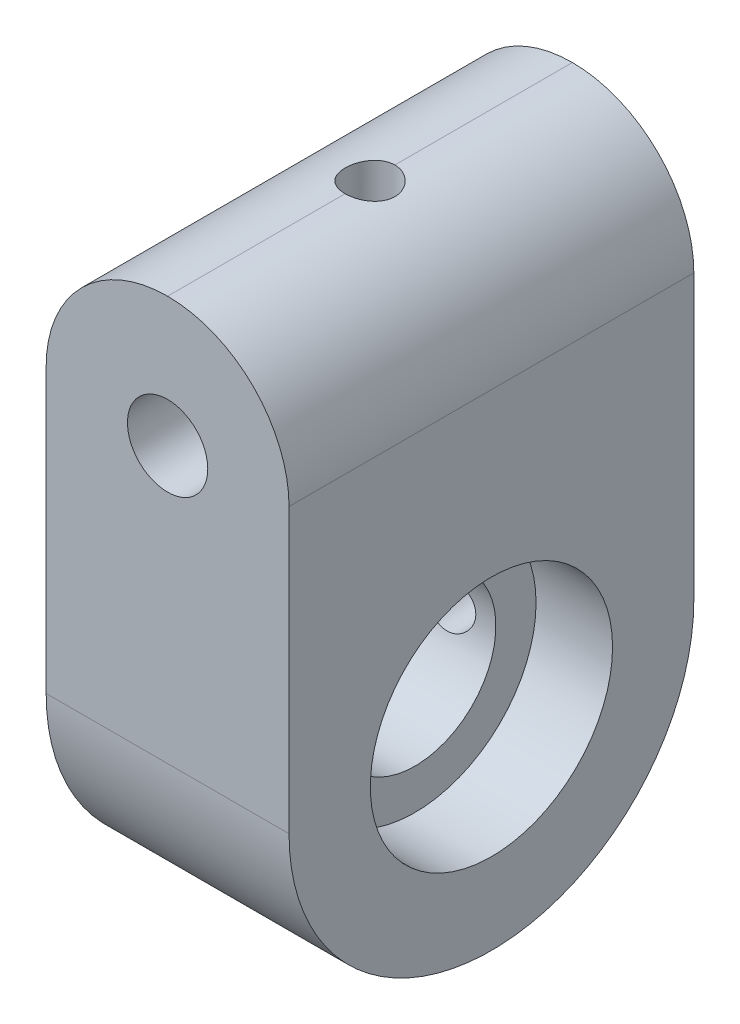
from build123d import *

# Parameters (mm, degrees)
SKETCH1_R               = 15.875
SKETCH1_R_2             = 9.5
BOSS_EXTRUDE1_DEPTH     = 6
BOSS_EXTRUDE2_START     = 13.050000011
SKETCH2_R               = 15.875
SKETCH2_R_2             = 9.5
SKETCH2_R_3             = 6.35
BOSS_EXTRUDE2_DEPTH     = 13.050000011
SKETCH3_R               = 1.95
CUT_EXTRUDE1_DEPTH      = 10.16
CUT_EXTRUDE3_REACH      = 39.82
CUT_EXTRUDE3_END_RADIUS = 6.35
BOSS_EXTRUDE3_REACH     = 31.444
SKETCH7_R               = 3.15
CUT_EXTRUDE4_DEPTH      = 31.75
CUT_EXTRUDE5_REACH      = 53.87
CUT_EXTRUDE5_END_RADIUS = 3.15
SKETCH8_R               = 1.95
FILLET1_R               = 9.525


with BuildPart() as part:
    # Sketch1 → Boss-Extrude1 (new body)
    with BuildSketch(Plane(origin=(0, 0, 0), x_dir=(0, 0, -1), z_dir=(1, 0, 0))):
        Circle(SKETCH1_R)
        Circle(SKETCH1_R_2, mode=Mode.SUBTRACT)
    extrude(amount=BOSS_EXTRUDE1_DEPTH)

    # Sketch2 → Boss-Extrude2 (add)
    # profile 1 of 2: a face of its own
    with BuildSketch(Plane.ZY.offset(BOSS_EXTRUDE2_START)):
        Circle(SKETCH2_R)
        with Locations(Location((0, 0, 0), (0, 0, 180))):
            Circle(SKETCH2_R_2, mode=Mode.SUBTRACT)
    # profile 2 of 2: a face of its own
    with BuildSketch(Plane.ZY.offset(BOSS_EXTRUDE2_START)):
        with Locations(Location((0, 0, 0), (0, 0, 180))):
            Circle(SKETCH2_R_2)
        Circle(SKETCH2_R_3, mode=Mode.SUBTRACT)
    extrude(amount=-BOSS_EXTRUDE2_DEPTH)

    # Sketch3 → Cut-Extrude1 (cut)
    with BuildSketch(Plane.ZY.offset(13.050000011)):
        with Locations((0, -12.7)):
            Circle(SKETCH3_R)
        with Locations((0, 12.7)):
            Circle(SKETCH3_R)
    extrude(amount=-CUT_EXTRUDE1_DEPTH, mode=Mode.SUBTRACT)

    # Cut-Extrude3: up to this cylinder (the profile starts outside it)
    cut_extrude3_end = Plane(origin=(-3.525, 0, 0), z_dir=(1, 0, 0)) * Cylinder(CUT_EXTRUDE3_END_RADIUS, 93.34, mode=Mode.PRIVATE)
    # Sketch5 → Cut-Extrude3 (cut, up to the surface)
    with BuildSketch(Plane.XY.offset(-15.875), mode=Mode.PRIVATE) as cut_extrude3_sk1:
        with BuildLine():
            ThreePointArc((-1.575000006, 0), (-3.525000006, 1.95), (-5.475000006, 0))
            Line((-5.475000006, 0), (-1.575000006, 0))
        make_face()
    cut_extrude3_tool1 = extrude(cut_extrude3_sk1.sketch, amount=CUT_EXTRUDE3_REACH, mode=Mode.PRIVATE) - cut_extrude3_end
    add(cut_extrude3_tool1.solids().sort_by_distance((-3.525, 0.827606, -15.875))[0], mode=Mode.SUBTRACT)
    # Sketch5 → Cut-Extrude3 (cut, up to the surface)
    with BuildSketch(Plane.XY.offset(-15.875), mode=Mode.PRIVATE) as cut_extrude3_sk2:
        with BuildLine():
            Line((-1.575000006, 0), (-5.475000006, 0))
            ThreePointArc((-5.475000006, 0), (-3.525000006, -1.95), (-1.575000006, 0))
        make_face()
    cut_extrude3_tool2 = extrude(cut_extrude3_sk2.sketch, amount=CUT_EXTRUDE3_REACH, mode=Mode.PRIVATE) - cut_extrude3_end
    add(cut_extrude3_tool2.solids().sort_by_distance((-3.525, -0.827606, -15.875))[0], mode=Mode.SUBTRACT)
    # Sketch5 → Cut-Extrude3 (cut, up to the surface)
    with BuildSketch(Plane.XY.offset(-15.875), mode=Mode.PRIVATE) as cut_extrude3_sk3:
        with BuildLine():
            ThreePointArc((-1.575000006, 0), (-3.525000006, 1.95), (-5.475000006, 0))
            Line((-5.475000006, 0), (-1.575000006, 0))
        make_face()
    cut_extrude3_tool3 = extrude(cut_extrude3_sk3.sketch, amount=CUT_EXTRUDE3_REACH, mode=Mode.PRIVATE) - cut_extrude3_end
    add(cut_extrude3_tool3.solids().sort_by_distance((-3.525, 0.827606, -15.875))[0], mode=Mode.SUBTRACT)
    # Sketch5 → Cut-Extrude3 (cut, up to the surface)
    with BuildSketch(Plane.XY.offset(-15.875), mode=Mode.PRIVATE) as cut_extrude3_sk4:
        with BuildLine():
            Line((-1.575000006, 0), (-5.475000006, 0))
            ThreePointArc((-5.475000006, 0), (-3.525000006, -1.95), (-1.575000006, 0))
        make_face()
    cut_extrude3_tool4 = extrude(cut_extrude3_sk4.sketch, amount=CUT_EXTRUDE3_REACH, mode=Mode.PRIVATE) - cut_extrude3_end
    add(cut_extrude3_tool4.solids().sort_by_distance((-3.525, -0.827606, -15.875))[0], mode=Mode.SUBTRACT)

    # Boss-Extrude3: up to this face of the body (flat: up to its plane)
    boss_extrude3_end = Plane(part.part.faces().sort_by_distance((6, 0, 15.425987194))[0])
    # Sketch6 → Boss-Extrude3 (add, up to the picked face)
    with BuildSketch(Plane.ZY.offset(13.050000011), mode=Mode.PRIVATE) as boss_extrude3_sk1:
        with BuildLine():
            Line((-15.875, 31.75), (-15.875, 0))
            ThreePointArc((-15.875, 0), (0, 15.875), (15.875, 0))
            Line((15.875, 0), (15.875, 31.75))
            Line((15.875, 31.75), (-15.875, 31.75))
        make_face()
    boss_extrude3_tool1 = split(extrude(boss_extrude3_sk1.sketch, amount=-BOSS_EXTRUDE3_REACH, mode=Mode.PRIVATE), bisect_by=boss_extrude3_end, keep=Keep.BOTH, mode=Mode.PRIVATE)
    add(boss_extrude3_tool1.solids().sort_by(Axis((-13.05, 21.783545, 0), (1, 0, 0)))[0])

    # Sketch7 → Cut-Extrude4 (cut)
    with BuildSketch(Plane.XY.offset(15.875)):
        with Locations((-3.525000006, 21.59)):
            Circle(SKETCH7_R)
    extrude(amount=-CUT_EXTRUDE4_DEPTH, mode=Mode.SUBTRACT)

    # Cut-Extrude5: up to this cylinder (the profile starts outside it)
    cut_extrude5_end = Plane(origin=(-3.525000006, 21.59, 0), z_dir=(0, 0, 1)) * Cylinder(CUT_EXTRUDE5_END_RADIUS, 115.04, mode=Mode.PRIVATE)
    # Sketch8 → Cut-Extrude5 (cut, up to the surface)
    with BuildSketch(Plane(origin=(0, 31.75, 0), x_dir=(1, 0, 0), z_dir=(0, 1, 0)), mode=Mode.PRIVATE) as cut_extrude5_sk1:
        with Locations(Location((-3.525000006, 0, 0), (0, 0, 270))):
            Circle(SKETCH8_R)
    cut_extrude5_tool1 = extrude(cut_extrude5_sk1.sketch, amount=-CUT_EXTRUDE5_REACH, mode=Mode.PRIVATE) - cut_extrude5_end
    add(cut_extrude5_tool1.solids().sort_by_distance((-3.525, 31.75, 0))[0], mode=Mode.SUBTRACT)

    # Fillet1
    # the kernel refuses this fillet: 9.525 mm, written as the material it takes off along each edge
    with BuildSketch(Plane(origin=(6, 31.75, 39.6875), x_dir=(0, -1, 0), z_dir=(0, 0, -1))) as fillet1_piece_1:
        with BuildLine():
            CenterArc((FILLET1_R, FILLET1_R), FILLET1_R, 180, 90)
            Line((0, FILLET1_R), (0, 0))
            Line((0, 0), (FILLET1_R, 0))
        make_face()
    extrude(amount=79.375, mode=Mode.SUBTRACT)
    with BuildSketch(Plane(origin=(-13.050000011, 31.75, 39.6875), x_dir=(0, -1, 0), z_dir=(0, 0, -1))) as fillet1_piece_2:
        with BuildLine():
            CenterArc((FILLET1_R, -FILLET1_R), FILLET1_R, 90, 90)
            Line((0, -FILLET1_R), (0, 0))
            Line((0, 0), (FILLET1_R, 0))
        make_face()
    extrude(amount=79.375, mode=Mode.SUBTRACT)


solid = part.part
